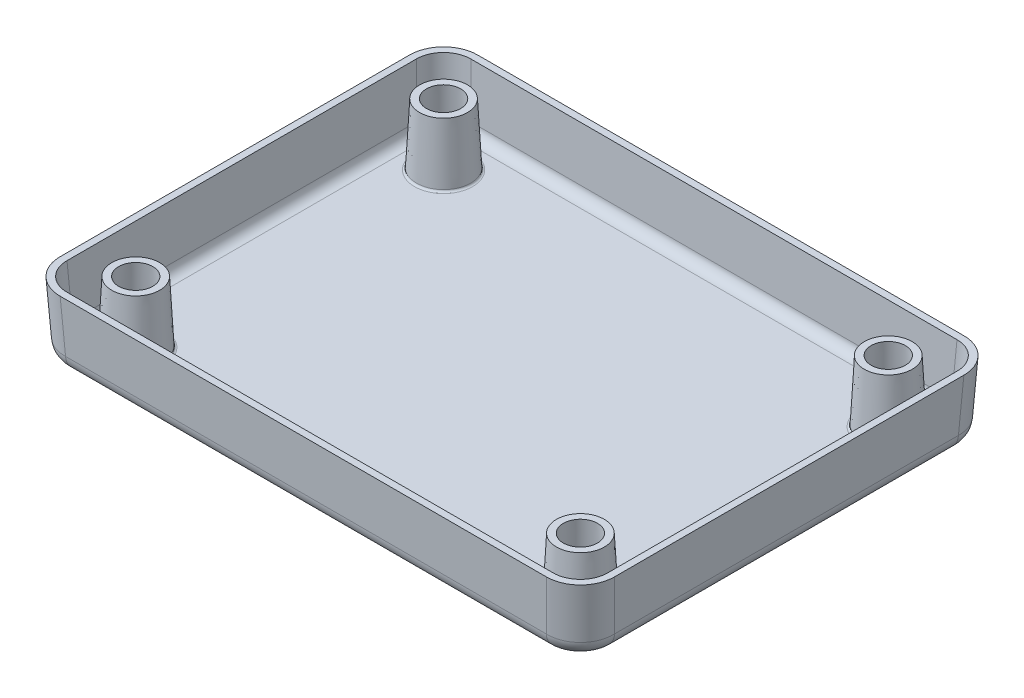
from build123d import *

# Parameters (mm, degrees)
BOSS_W          = 101.6
BOSS_H          = 76.2
BOSS_R          = 6.35
MAIN_BOSS_DEPTH = 25.4
DRAFT1_ANGLE    = 3
DRAFT2_ANGLE    = -3
FILLET1_R       = 12.7
FILLET2_R       = 6.35
SHELL1_T        = -2.54
FILLET3_R       = 0.762
FILLET4_R       = 0.762


with BuildPart() as part:
    # BOSS → MAIN_BOSS (new body)
    with BuildSketch(Plane(origin=(0, 0, 0), x_dir=(1, 0, 0), z_dir=(0, 1, 0))):
        with Locations((50.8, 38.1)):
            Rectangle(BOSS_W, BOSS_H)
        with Locations((82.55, 57.15)):
            Circle(BOSS_R, mode=Mode.SUBTRACT)
    extrude(amount=MAIN_BOSS_DEPTH)

    # Draft1
    draft1_faces = [part.faces().sort_by_distance(p)[0] for p in [
        (50.8, 12.7, -76.2),
        (101.6, 12.7, -38.1),
    ]]
    draft(draft1_faces, Plane(origin=(0, 0, 0), x_dir=(0, 0, -1), z_dir=(0, -1, 0)), DRAFT1_ANGLE)

    # Draft2
    draft2_faces = [part.faces().sort_by_distance(p)[0] for p in [
        (76.2, 12.7, -57.15),
    ]]
    draft(draft2_faces, Plane.ZX.offset(25.4), DRAFT2_ANGLE)

    # Fillet1
    fillet1_edges = [part.edges().sort_by_distance(p)[0] for p in [
        (102.265578797, 12.7, -76.865578797),
    ]]
    fillet(fillet1_edges, radius=FILLET1_R)

    # Fillet2
    fillet2_edges = [part.edges().sort_by_distance(p)[0] for p in [
        (44.458702454, 0, -76.2),
        (97.887458497, 0, -72.487458497),
        (101.6, 0, -31.758702454),
    ]]
    fillet(fillet2_edges, radius=FILLET2_R)

    # Shell1
    shell1_openings = [part.faces().sort_by_distance(p)[0] for p in [
        (50.747485491, 25.4, -38.309249016),
        (50.988163553, 12.761210563, 0),
        (0, 12.781516987, -38.290149163),
    ]]
    offset(amount=SHELL1_T, openings=shell1_openings, kind=Kind.INTERSECTION)

    # Fillet3
    fillet3_edges = [part.edges().sort_by_distance(p)[0] for p in [
        (72.458472407, 2.54, -57.15),
    ]]
    fillet(fillet3_edges, radius=FILLET3_R)

    # Fillet4
    fillet4_edges = [part.edges().sort_by_distance(p)[0] for p in [
        (74.868842406, 0, -57.15),
    ]]
    fillet(fillet4_edges, radius=FILLET4_R)

    # Mirror1: part across plane


with BuildPart() as part_1:
    add(part.part)
    add(part.part.mirror(Plane(origin=(0, 25.4, 0), x_dir=(0, 0, 1), z_dir=(1, 0, 0))))

    # Mirror2: part across plane


with BuildPart() as part_2:
    add(part_1.part)
    add(part_1.part.mirror(Plane(origin=(0, 25.4, 0), x_dir=(1, 0, 0), z_dir=(0, 0, -1))))


solid = part_2.part
